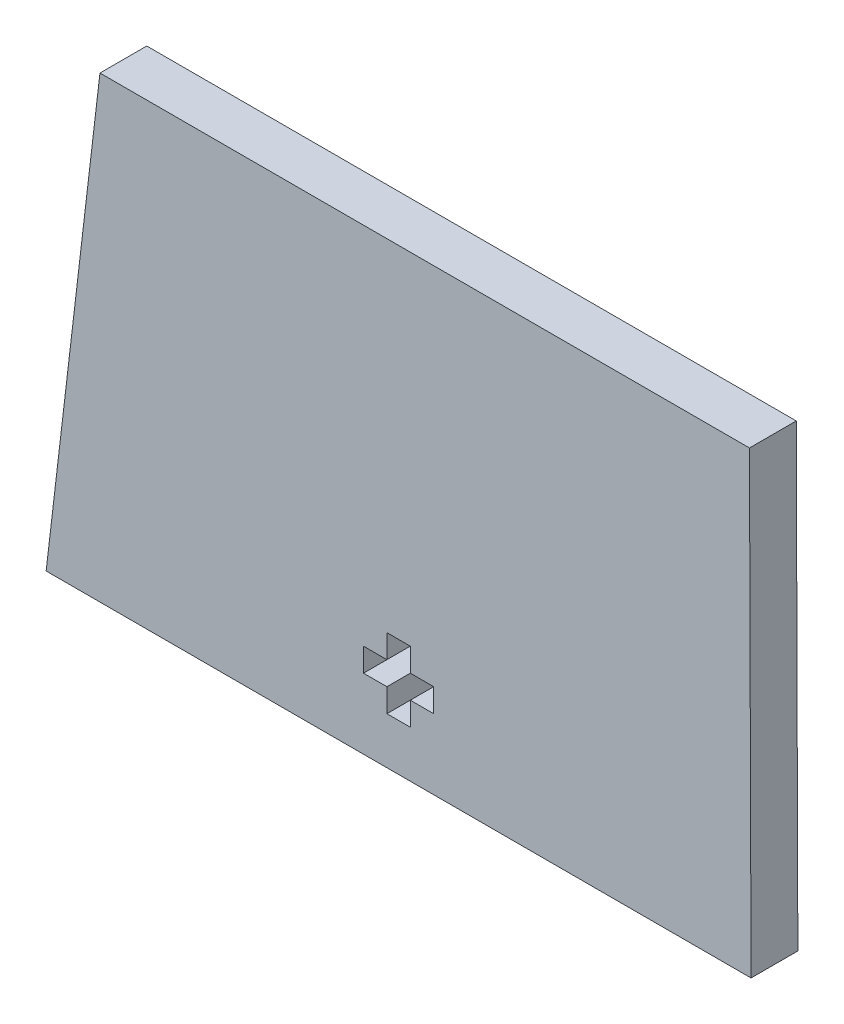
from build123d import *

# Parameters (mm, degrees)
AUFSATZ_LINEAR_AUSTRAGEN1_DEPTH = 2
SCHNITT_LINEAR_AUSTRAGEN1_DEPTH = 36.986175697


with BuildPart() as part:
    # Skizze1 → Aufsatz-Linear austragen1 (new body)
    with BuildSketch(Plane.XY):
        Polygon((0, 0), (2.300163582, 19.580359356), (30.056642573, 19.582880694), (30.125, 0), align=None)
    extrude(amount=AUFSATZ_LINEAR_AUSTRAGEN1_DEPTH)

    # Skizze5 → Schnitt-Linear austragen1 (cut, through all)
    with BuildSketch(Plane.XY.offset(2)):
        Polygon((13.5625, 3), (14.5625, 3), (14.5625, 2), (15.0625, 2), (15.5625, 2), (15.5625, 3), (16.5625, 3), (16.5625, 4), (15.5625, 4), (15.5625, 5), (14.5625, 5), (14.5625, 4), (13.5625, 4), align=None)
    extrude(amount=-SCHNITT_LINEAR_AUSTRAGEN1_DEPTH, mode=Mode.SUBTRACT)


solid = part.part
